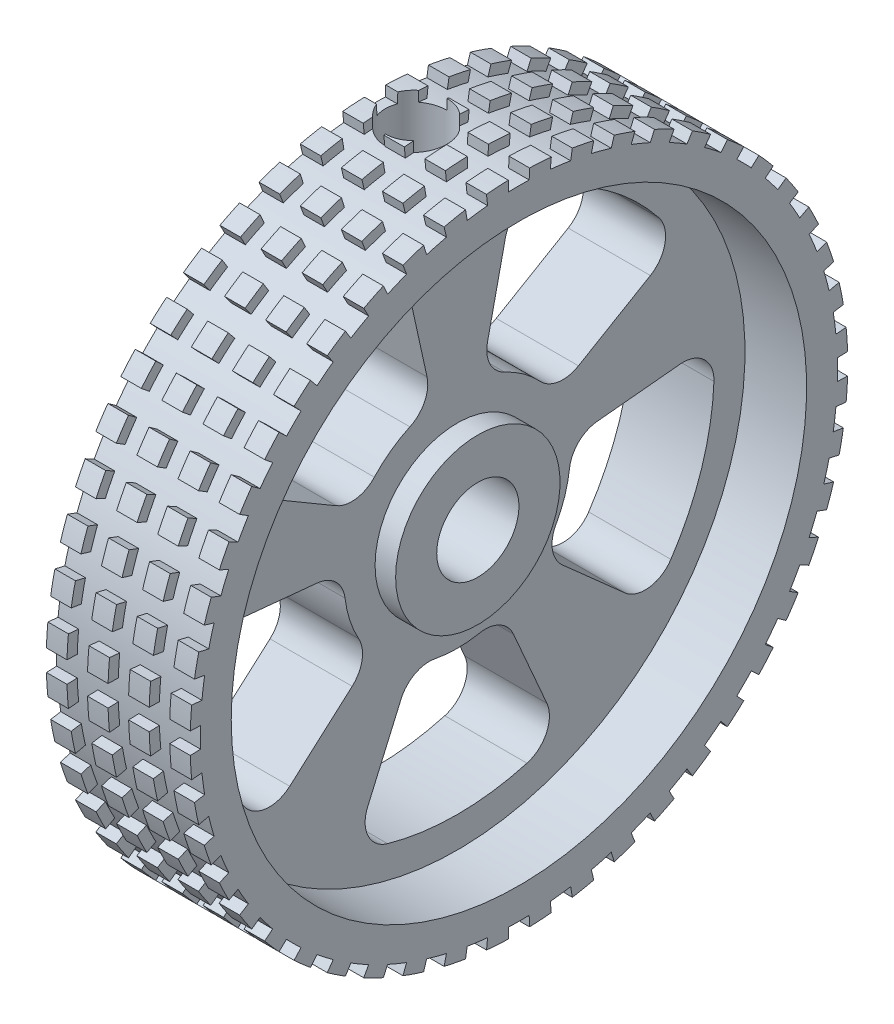
from build123d import *
from build123d.topology import SkipClean

# Parameters (mm, degrees)
SKETCH3_W                = 1
SKETCH3_H                = 0.5
CUT_EXTRUDE3_DEPTH       = 24.6854387
CIRPATTERN2_COUNT        = 48
LPATTERN1_COUNT          = 3
LPATTERN1_PITCH          = 2
CUT_EXTRUDE4_DEPTH       = 23.966676946
FILLET2_R                = 1.5
CIRPATTERN3_COUNT        = 5
FILLET2_OF_CIRPATTERN3_R = 1.5


with BuildPart() as part:
    # Sketch1 → Revolve1 (revolve)
    with BuildSketch(Plane.XY):
        Polygon((0, 2), (5, 2), (5, 4), (4, 4), (4, 14), (7, 14), (7, 16), (0, 16), align=None)
    revolve(axis=Axis((0, 0, 0), (1, 0, 0)))

    # Sketch2 → Cut-Revolve1 (revolve, cut)
    with BuildSketch(Plane.XY):
        Polygon((2, 0), (2.9, 0), (2.9, 11.5), (3.5, 11.5), (3.5, 16), (2, 16), align=None)
    revolve(axis=Axis((2, 0, 0), (0, 1, 0)), mode=Mode.SUBTRACT)

    # Sketch3 → Cut-Revolve2 (revolve, cut)
    with BuildSketch(Plane.XY):
        with Locations((5.5, 15.75)):
            Rectangle(SKETCH3_W, SKETCH3_H)
    cut_revolve2 = revolve(axis=Axis((0, 0, 0), (1, 0, 0)), mode=Mode.SUBTRACT)

    # Sketch4 → Cut-Extrude3 (cut, through all)
    with BuildSketch(Plane(origin=(0, 0, 0), x_dir=(0, 0, -1), z_dir=(1, 0, 0))):
        with BuildLine():
            Line((0.515632645, 15.991689185), (0.5, 15.491933385))
            ThreePointArc((0.5, 15.491933385), (0, 15.5), (-0.5, 15.491933385))
            Line((-0.5, 15.491933385), (-0.515632645, 15.991689185))
            ThreePointArc((-0.515632645, 15.991689185), (0, 16), (0.515632645, 15.991689185))
        make_face()
    cut_extrude3 = extrude(amount=CUT_EXTRUDE3_DEPTH, mode=Mode.SUBTRACT)

    # CirPattern2: Cut-Extrude3 ×48 about axis
    with SkipClean():  # the faces are left unmerged after this step: merging them gives an invalid solid
        cirpattern2_axis = Axis((0, 0, 0), (-1, 0, 0))
        for i in range(1, CIRPATTERN2_COUNT):
            add(cut_extrude3.rotate(cirpattern2_axis, i * 360 / CIRPATTERN2_COUNT), mode=Mode.SUBTRACT)

    # LPattern1: Cut-Revolve2 ×3
    with SkipClean():  # the faces are left unmerged after this step: merging them gives an invalid solid
        with Locations(*[(-i * LPATTERN1_PITCH, 0, 0) for i in range(1, LPATTERN1_COUNT)]):
            add(cut_revolve2, mode=Mode.SUBTRACT)

    # Sketch6 → Cut-Extrude4 (cut, through all)
    with SkipClean():  # the faces are left unmerged after this step: merging them gives an invalid solid
        with BuildSketch(Plane(origin=(4, 0, 0), x_dir=(0, 0, -1), z_dir=(1, 0, 0))):
            with BuildLine():
                Line((-5, -11.456439237), (-2.2, -5.040833264))
                ThreePointArc((-2.2, -5.040833264), (0, -5.5), (2.2, -5.040833264))
                Line((2.2, -5.040833264), (5, -11.456439237))
                ThreePointArc((5, -11.456439237), (0, -12.5), (-5, -11.456439237))
            make_face()
        cut_extrude4 = extrude(amount=-CUT_EXTRUDE4_DEPTH, mode=Mode.SUBTRACT)

    # Fillet2
    fillet2_edges = [part.edges().sort_by_distance(p)[0] for p in [
        (2, -11.456439237, -5),
        (2, -5.040833264, 2.2),
        (2, -11.456439237, 5),
        (2, -5.040833264, -2.2),
    ]]
    fillet(fillet2_edges, radius=FILLET2_R)

    # CirPattern3: Cut-Extrude4 ×5 about axis
    with SkipClean():  # the faces are left unmerged after this step: merging them gives an invalid solid
        cirpattern3_axis = Axis((5, 0, 0), (-1, 0, 0))
        for i in range(1, CIRPATTERN3_COUNT):
            add(cut_extrude4.rotate(cirpattern3_axis, i * 360 / CIRPATTERN3_COUNT), mode=Mode.SUBTRACT)

    # Fillet2 of CirPattern3
    fillet2_of_cirpattern3_edges = [part.edges().sort_by_distance(p)[0] for p in [
        (2, -8.295517001, 9.350636218),
        (2, 0.534621191, 5.473954711),
        (2, 1.215048162, 12.440806162),
        (2, -3.65002748, 4.114279936),
        (2, 6.329527777, 10.779010999),
        (2, 5.371247332, 1.183090064),
        (2, 12.2073803, 2.688841056),
        (2, 2.784992222, 4.74276484),
        (2, 12.2073803, -2.688841056),
        (2, 2.784992222, -4.74276484),
        (2, 6.329527777, -10.779010999),
        (2, 5.371247332, -1.183090064),
        (2, 1.215048162, -12.440806162),
        (2, -3.65002748, -4.114279936),
        (2, -8.295517001, -9.350636218),
        (2, 0.534621191, -5.473954711),
    ]]
    fillet(fillet2_of_cirpattern3_edges, radius=FILLET2_OF_CIRPATTERN3_R)


solid = part.part
